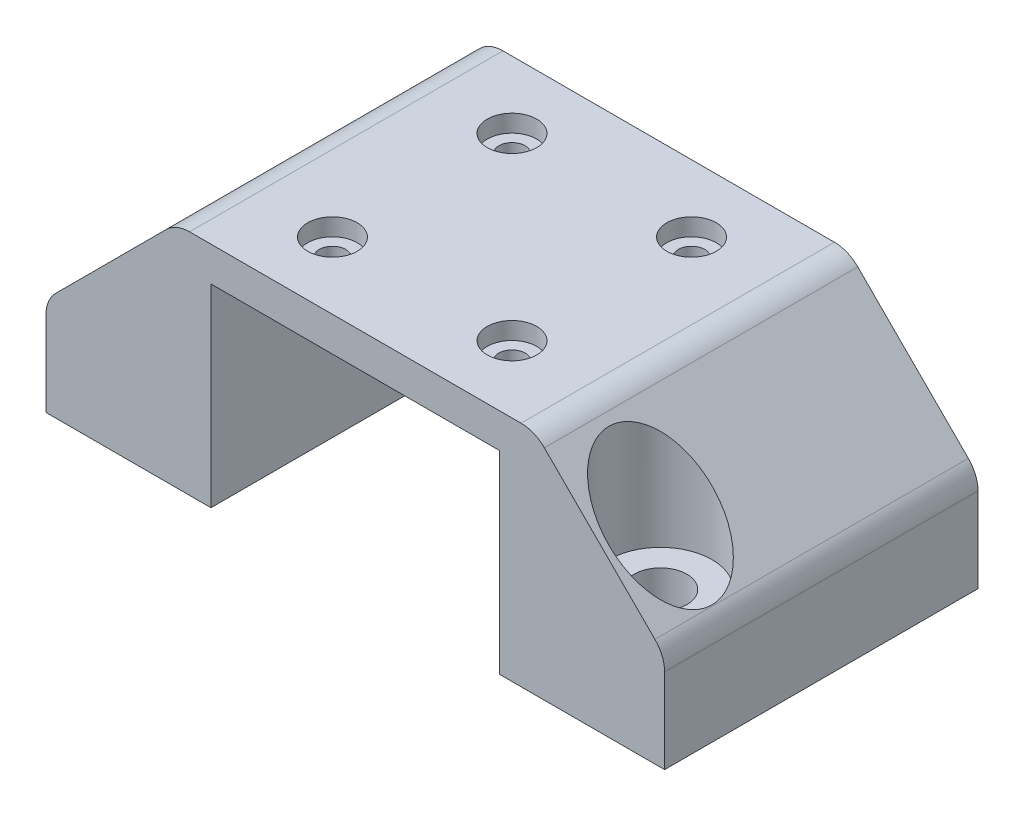
from build123d import *

# Parameters (mm, degrees)
BOSS_EXTRUDE1_DEPTH = 24.13
CHAMFER1_SIZE       = 10
FILLET1_R           = 2.54
FILLET2_R           = 2.54
SKETCH2_R           = 2.032
CUT_EXTRUDE1_DEPTH  = 10.16
SKETCH3_R           = 1.016
CUT_EXTRUDE2_DEPTH  = 39.185845946
SKETCH4_R           = 1.905
CUT_EXTRUDE3_DEPTH  = 1.3335
SKETCH5_R           = 2.032
CUT_EXTRUDE4_DEPTH  = 10.16
SKETCH7_R           = 3.96875
CUT_EXTRUDE5_DEPTH  = 10.16


with BuildPart() as part:
    # Sketch1 → Boss-Extrude1 (new body)
    with BuildSketch(Plane.XY):
        Polygon((-11.1125, 0), (-11.1125, 14.9225), (11.1125, 14.9225), (11.1125, 0), (23.8125, 0), (23.8125, 17.574605951), (-23.8125, 17.574605951), (-23.8125, 0), align=None)
    extrude(amount=BOSS_EXTRUDE1_DEPTH)

    # Chamfer1
    chamfer1_edges = [part.edges().sort_by_distance(p)[0] for p in [
        (23.8125, 17.574605951, 12.065),
        (-23.8125, 17.574605951, 12.065),
    ]]
    chamfer(chamfer1_edges, length=CHAMFER1_SIZE)

    # Fillet1
    fillet1_edges = [part.edges().sort_by_distance(p)[0] for p in [
        (13.8125, 17.574605951, 12.065),
        (-13.8125, 17.574605951, 12.065),
    ]]
    fillet(fillet1_edges, radius=FILLET1_R)

    # Fillet2
    fillet2_edges = [part.edges().sort_by_distance(p)[0] for p in [
        (23.8125, 7.574605951, 12.065),
        (-23.8125, 7.574605951, 12.065),
    ]]
    fillet(fillet2_edges, radius=FILLET2_R)

    # Sketch2 → Cut-Extrude1 (cut)
    with BuildSketch(Plane.XZ):
        with Locations((-19.05, 19.685)):
            Circle(SKETCH2_R)
        with Locations((19.05, 19.685)):
            Circle(SKETCH2_R)
    extrude(amount=-CUT_EXTRUDE1_DEPTH, mode=Mode.SUBTRACT)

    # Sketch3 → Cut-Extrude2 (cut, through all)
    with BuildSketch(Plane(origin=(0, 17.574605951, 0), x_dir=(1, 0, 0), z_dir=(0, 1, 0))):
        with Locations((-6.91134, -5.15366)):
            Circle(SKETCH3_R)
        with Locations((6.91134, -5.15366)):
            Circle(SKETCH3_R)
        with Locations((6.91134, -18.97634)):
            Circle(SKETCH3_R)
        with Locations((-6.91134, -18.97634)):
            Circle(SKETCH3_R)
    extrude(amount=-CUT_EXTRUDE2_DEPTH, mode=Mode.SUBTRACT)

    # Sketch4 → Cut-Extrude3 (cut)
    with BuildSketch(Plane(origin=(0, 17.574605951, 0), x_dir=(1, 0, 0), z_dir=(0, 1, 0))):
        with Locations((-6.91134, -5.15366)):
            Circle(SKETCH4_R)
        with Locations((6.91134, -5.15366)):
            Circle(SKETCH4_R)
        with Locations((6.91134, -18.97634)):
            Circle(SKETCH4_R)
        with Locations((-6.91134, -18.97634)):
            Circle(SKETCH4_R)
    extrude(amount=-CUT_EXTRUDE3_DEPTH, mode=Mode.SUBTRACT)

    # Sketch5 → Cut-Extrude4 (cut)
    with BuildSketch(Plane.XZ):
        with Locations((-19.05, 4.445)):
            Circle(SKETCH5_R)
        with Locations((19.05, 4.445)):
            Circle(SKETCH5_R)
    extrude(amount=-CUT_EXTRUDE4_DEPTH, mode=Mode.SUBTRACT)

    # Sketch7 → Cut-Extrude5 (cut)
    with BuildSketch(Plane(origin=(0, 17.574605951, 0), x_dir=(1, 0, 0), z_dir=(0, 1, 0))):
        with Locations((19.05, -19.685)):
            Circle(SKETCH7_R)
        with Locations((-19.05, -19.685)):
            Circle(SKETCH7_R)
    extrude(amount=-CUT_EXTRUDE5_DEPTH, mode=Mode.SUBTRACT)


solid = part.part
